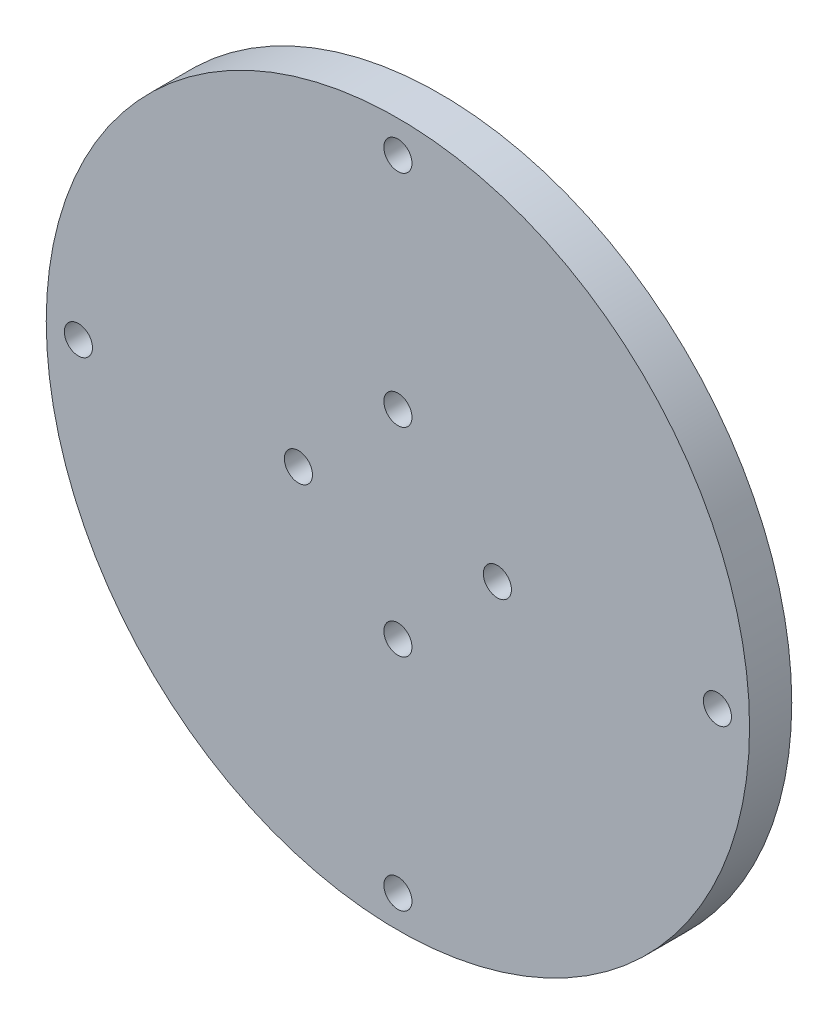
from build123d import *

# Parameters (mm, degrees)
SKETCH1_R           = 25
SKETCH1_R_2         = 1
BOSS_EXTRUDE1_DEPTH = 1.5


with BuildPart() as part:
    # Sketch1 → Boss-Extrude1 (new, symmetric)
    with BuildSketch(Plane.XY):
        Circle(SKETCH1_R)
        with Locations((0, -22.714)):
            Circle(SKETCH1_R_2, mode=Mode.SUBTRACT)
        with Locations((0, -7.071067812)):
            Circle(SKETCH1_R_2, mode=Mode.SUBTRACT)
        with Locations((-22.714, 0)):
            Circle(SKETCH1_R_2, mode=Mode.SUBTRACT)
        with Locations((-7.071067812, 0)):
            Circle(SKETCH1_R_2, mode=Mode.SUBTRACT)
        with Locations((7.071067812, 0)):
            Circle(SKETCH1_R_2, mode=Mode.SUBTRACT)
        with Locations((0, 7.071067812)):
            Circle(SKETCH1_R_2, mode=Mode.SUBTRACT)
        with Locations((22.714, 0)):
            Circle(SKETCH1_R_2, mode=Mode.SUBTRACT)
        with Locations((0, 22.714)):
            Circle(SKETCH1_R_2, mode=Mode.SUBTRACT)
    extrude(amount=BOSS_EXTRUDE1_DEPTH, both=True)


solid = part.part
